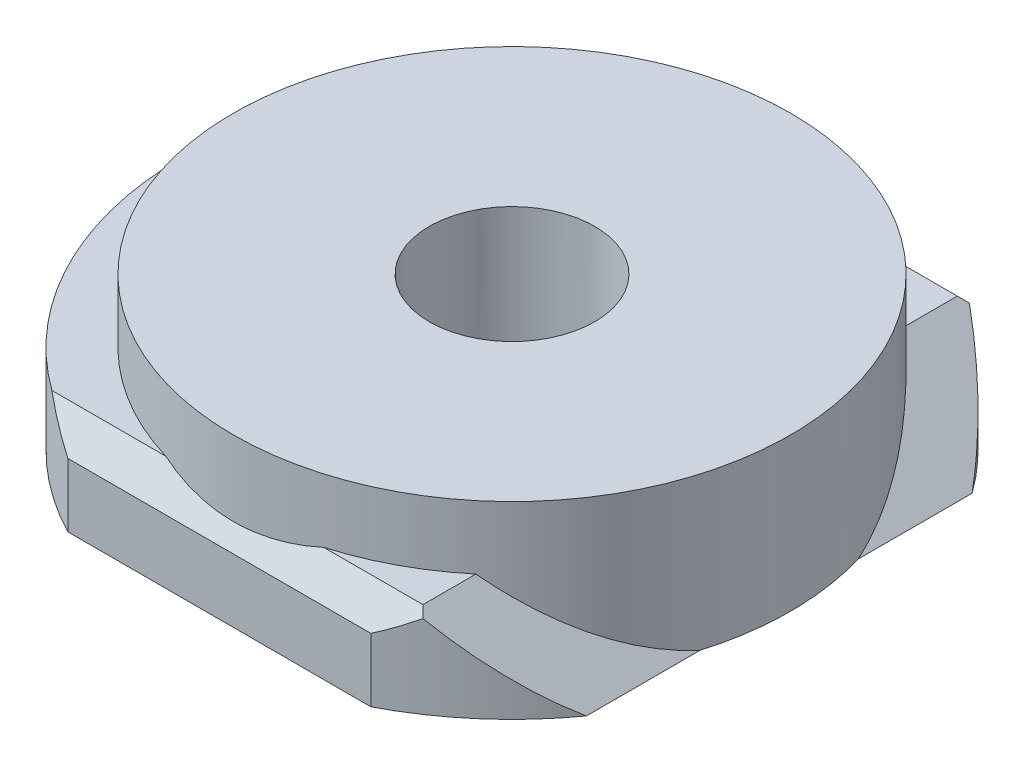
from build123d import *

# Parameters (mm, degrees)
SKETCH1_R               = 10.95
SKETCH1_R_2             = 6.05
BOSS_EXTRUDE1_DEPTH     = 2
BOSS_EXTRUDE2_START     = 12
SKETCH1_3_R             = 10.95
SKETCH1_3_R_2           = 6.05
BOSS_EXTRUDE2_DEPTH     = 12
BOSS_EXTRUDE3_START     = -2.5
SKETCH2_R               = 12.95
SKETCH2_R_2             = 10.95
BOSS_EXTRUDE3_DEPTH     = 11.5
CUT_EXTRUDE1_DEPTH      = 22.895319134
CUT_EXTRUDE1_DEPTH_BACK = 22.895319134
SKETCH3_W               = 100
SKETCH3_H               = 23
CUT_EXTRUDE3_DEPTH      = 22.07018035
CUT_EXTRUDE3_DEPTH_BACK = 22.07018035
BOSS_EXTRUDE4_START     = 12
SKETCH1_5_R             = 10.95
SKETCH1_5_R_2           = 6.05
BOSS_EXTRUDE4_DEPTH     = 12
CHAMFER1_SIZE           = 1
BOSS_EXTRUDE5_START     = 12
SKETCH7_R               = 6.05
BOSS_EXTRUDE5_DEPTH     = 12
CUT_EXTRUDE5_DEPTH      = 22.07018035
CUT_EXTRUDE5_DEPTH_BACK = 22.07018035
SKETCH6_R               = 3.25
CUT_EXTRUDE7_START      = -8
CUT_EXTRUDE7_DEPTH      = 8


with BuildPart() as part:
    # Sketch1 → Boss-Extrude1 (new body)
    # profile 1 of 2: a face of its own
    with BuildSketch(Plane(origin=(0, 0, 0), x_dir=(1, 0, 0), z_dir=(0, 1, 0))):
        with Locations(Location((0, 0, 0), (0, 0, 270))):
            Circle(SKETCH1_R)
        Circle(SKETCH1_R_2, mode=Mode.SUBTRACT)
    # profile 2 of 2: a face of its own
    with BuildSketch(Plane(origin=(0, 0, 0), x_dir=(1, 0, 0), z_dir=(0, 1, 0))):
        Circle(SKETCH1_R_2)
    extrude(amount=-BOSS_EXTRUDE1_DEPTH)

    # Sketch1<3> → Boss-Extrude2 (add)
    with BuildSketch(Plane(origin=(0, 0, 0), x_dir=(1, 0, 0), z_dir=(0, 1, 0)).offset(BOSS_EXTRUDE2_START)):
        with Locations(Location((0, 0, 0), (0, 0, 270))):
            Circle(SKETCH1_3_R)
        with Locations(Location((0, 0, 0), (0, 0, 270))):
            Circle(SKETCH1_3_R_2, mode=Mode.SUBTRACT)
    extrude(amount=-BOSS_EXTRUDE2_DEPTH)

    # Sketch2 → Boss-Extrude3 (add)
    with BuildSketch(Plane(origin=(0, 12, 0), x_dir=(1, 0, 0), z_dir=(0, 1, 0)).offset(BOSS_EXTRUDE3_START)):
        with Locations(Location((0, 0, 0), (0, 0, 270))):
            Circle(SKETCH2_R)
        with Locations(Location((0, 0, 0), (0, 0, 270))):
            Circle(SKETCH2_R_2, mode=Mode.SUBTRACT)
    extrude(amount=-BOSS_EXTRUDE3_DEPTH)

    # Sketch3 → Cut-Extrude1 (cut, two sides: drawn at the far end of the back side and taken through both)
    with BuildSketch(Plane(origin=(0, 0, 0), x_dir=(1, 0, 0), z_dir=(0, 1, 0)).offset(-CUT_EXTRUDE1_DEPTH_BACK)):
        with Locations((0, -23)):
            Rectangle(SKETCH3_W, SKETCH3_H)
        with Locations((0, 23)):
            Rectangle(SKETCH3_W, SKETCH3_H)
    extrude(amount=CUT_EXTRUDE1_DEPTH + CUT_EXTRUDE1_DEPTH_BACK, mode=Mode.SUBTRACT)

    # Sketch4 → Cut-Extrude3 (cut, two sides: drawn at the far end of the back side and taken through both)
    with BuildSketch(Plane.XY.offset(-CUT_EXTRUDE3_DEPTH_BACK)):
        Polygon((13, 12), (4.5, 12), (13, 3.5), align=None)
    extrude(amount=CUT_EXTRUDE3_DEPTH + CUT_EXTRUDE3_DEPTH_BACK, mode=Mode.SUBTRACT)

    # Sketch1<5> → Boss-Extrude4 (add)
    with BuildSketch(Plane(origin=(0, 0, 0), x_dir=(1, 0, 0), z_dir=(0, 1, 0)).offset(BOSS_EXTRUDE4_START)):
        with Locations(Location((0, 0, 0), (0, 0, 270))):
            Circle(SKETCH1_5_R)
        with Locations(Location((0, 0, 0), (0, 0, 270))):
            Circle(SKETCH1_5_R_2, mode=Mode.SUBTRACT)
    extrude(amount=-BOSS_EXTRUDE4_DEPTH)

    # Chamfer1
    # the kernel refuses this chamfer: 1 mm, written as the material it takes off along each edge
    with BuildSketch(Plane(origin=(8.525883186, 9.5, 11.5), x_dir=(0, 0.027495876610585647, -0.9996219169112968), z_dir=(-1, 0, 0))) as chamfer1_piece_1_section:
        Polygon((CHAMFER1_SIZE * 0.999621916911, CHAMFER1_SIZE * 0.0274958766106), (-CHAMFER1_SIZE * 0.0274958766106, CHAMFER1_SIZE * 0.999621916911), (0, 0), align=None)
    chamfer1_piece_1 = extrude(amount=17.051766372, mode=Mode.PRIVATE)
    chamfer1_piece_1 = chamfer1_piece_1 - Plane(origin=(0, 9.159933663, 0), x_dir=(0, 0, 1), z_dir=(0, 1, 0)) * Cylinder(10.95, 39, mode=Mode.PRIVATE)
    add(chamfer1_piece_1, mode=Mode.SUBTRACT)
    with BuildSketch(Plane(origin=(8.525883186, 9.5, -11.5), x_dir=(0, 0.027495876610585647, 0.9996219169112968), z_dir=(-1, 0, 0))) as chamfer1_piece_2_section:
        Polygon((CHAMFER1_SIZE * 0.999621916911, -CHAMFER1_SIZE * 0.0274958766106), (-CHAMFER1_SIZE * 0.0274958766106, -CHAMFER1_SIZE * 0.999621916911), (0, 0), align=None)
    chamfer1_piece_2 = extrude(amount=17.051766372, mode=Mode.PRIVATE)
    chamfer1_piece_2 = chamfer1_piece_2 - Plane(origin=(0, 9.159933662, 0), x_dir=(0, 0, 1), z_dir=(0, 1, 0)) * Cylinder(10.95, 39, mode=Mode.PRIVATE)
    add(chamfer1_piece_2, mode=Mode.SUBTRACT)

    # Sketch7 → Boss-Extrude5 (add)
    with BuildSketch(Plane(origin=(0, 0, 0), x_dir=(1, 0, 0), z_dir=(0, 1, 0)).offset(BOSS_EXTRUDE5_START)):
        Circle(SKETCH7_R)
    extrude(amount=-BOSS_EXTRUDE5_DEPTH)

    # Sketch6 → Cut-Extrude5 (cut, two sides: drawn at the far end of the back side and taken through both)
    with BuildSketch(Plane(origin=(0, 0, 0), x_dir=(1, 0, 0), z_dir=(0, 1, 0)).offset(-CUT_EXTRUDE5_DEPTH_BACK)):
        with Locations(Location((0, 0, 0), (0, 0, 270))):
            Circle(SKETCH6_R)
    extrude(amount=CUT_EXTRUDE5_DEPTH + CUT_EXTRUDE5_DEPTH_BACK, mode=Mode.SUBTRACT)

    # Sketch9 → Cut-Extrude7 (cut)
    with BuildSketch(Plane.XZ.offset(2).offset(CUT_EXTRUDE7_START)):
        with BuildLine():
            Line((5.954200198, 11.5), (-5.954200198, 11.5))
            ThreePointArc((-5.954200198, 11.5), (-12.95, 0), (-5.954200198, -11.5))
            Line((-5.954200198, -11.5), (5.954200198, -11.5))
            ThreePointArc((5.954200198, -11.5), (12.95, 0), (5.954200198, 11.5))
        make_face()
    extrude(amount=CUT_EXTRUDE7_DEPTH, mode=Mode.SUBTRACT)


solid = part.part
